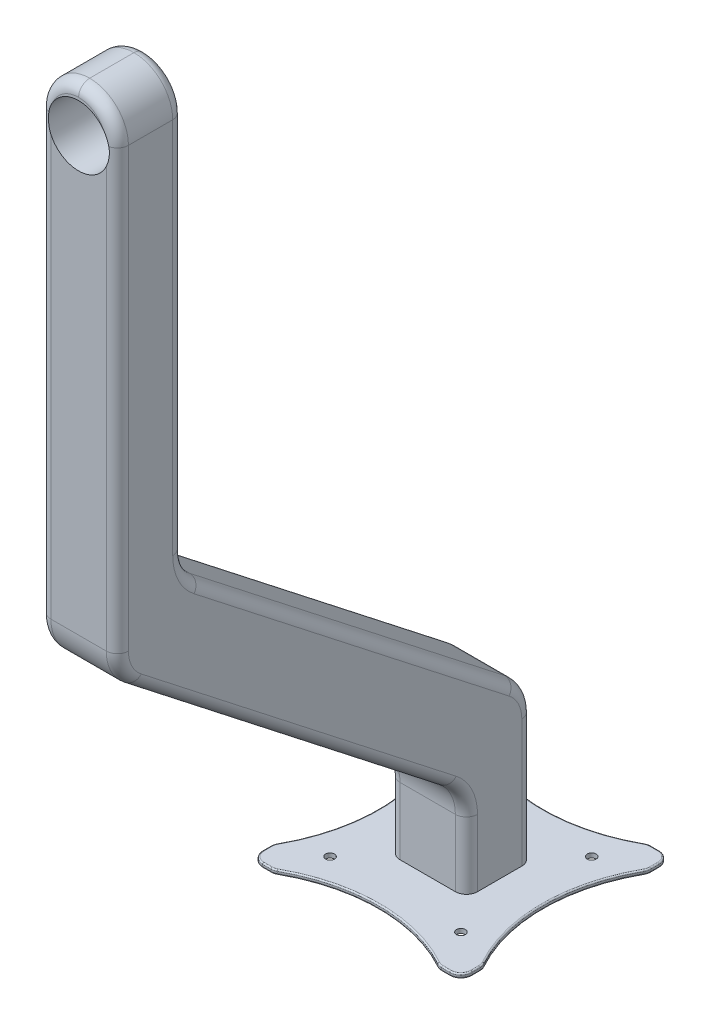
from build123d import *

# Parameters (mm, degrees)
SKETCH1_R           = 2.5526999999999975
BOSS_EXTRUDE1_DEPTH = 2.54
FILLET1_R           = 6.35
BOSS_EXTRUDE2_DEPTH = 22.224999999999998
SKETCH4_R           = 17.462499999999967
CUT_EXTRUDE1_DEPTH  = 555.267869804406
FILLET2_R           = 22.225
FILLET3_R           = 25.4
FILLET4_R           = 6.35
FILLET5_R           = 0.762


# Some blends are built 0.0001 mm under size
with BuildPart() as part:
    # Sketch1 → Boss-Extrude1 (new body)
    with BuildSketch(Plane(origin=(0, 0, 0), x_dir=(1, 0, 0), z_dir=(0, 1, 0))):
        with BuildLine():
            Line((-60, 59.99999999999999), (-47.3, 59.999999999999986))
            ThreePointArc((-47.3, 59.999999999999986), (-1.503e-14, 47.3), (47.29999999999998, 60))
            Line((47.29999999999998, 60), (59.999999999999986, 59.99999999999999))
            Line((59.999999999999986, 59.99999999999999), (60.000000000000014, 47.300000000000026))
            ThreePointArc((60.000000000000014, 47.300000000000026), (47.300000000000026, 3.759e-14), (60.000000000000014, -47.299999999999976))
            Line((60.000000000000014, -47.299999999999976), (60, -60.00000000000001))
            Line((60, -60.00000000000001), (47.30000000000003, -60.00000000000001))
            ThreePointArc((47.30000000000003, -60.00000000000001), (1.936e-14, -47.30000000000001), (-47.299999999999955, -60.000000000000014))
            Line((-47.299999999999955, -60.000000000000014), (-59.999999999999986, -60.00000000000001))
            Line((-59.999999999999986, -60.00000000000001), (-59.99999999999998, -47.30000000000004))
            ThreePointArc((-59.99999999999998, -47.30000000000004), (-47.29999999999998, -3.281e-14), (-59.99999999999999, 47.29999999999997))
            Line((-59.99999999999999, 47.29999999999997), (-60, 59.99999999999999))
        make_face()
        with Locations(Location((-37.500000000000014, 37.49999999999999, 0), (0, 0, 270))):
            Circle(SKETCH1_R, mode=Mode.SUBTRACT)
        with Locations(Location((-37.5, -37.50000000000001, 0), (0, 0, 270))):
            Circle(SKETCH1_R, mode=Mode.SUBTRACT)
        with Locations(Location((37.5, -37.50000000000001, 0), (0, 0, 270))):
            Circle(SKETCH1_R, mode=Mode.SUBTRACT)
        with Locations(Location((37.499999999999986, 37.49999999999999, 0), (0, 0, 270))):
            Circle(SKETCH1_R, mode=Mode.SUBTRACT)
    extrude(amount=BOSS_EXTRUDE1_DEPTH)

    # Fillet1
    fillet1_edges = [part.edges().sort_by_distance(p)[0] for p in [
        (60, 1.27, 60.00000000000001),
        (47.30000000000003, 1.27, 60),
        (-47.29999999999996, 1.27, 60.00000000000001),
        (-59.999999999999986, 1.27, 60.00000000000001),
        (-59.99999999999997, 1.27, 47.30000000000004),
        (-60, 1.27, -47.299999999999976),
        (-60, 1.27, -59.99999999999999),
        (-47.3, 1.27, -59.99999999999998),
        (47.29999999999999, 1.27, -59.99999999999999),
        (59.999999999999986, 1.27, -59.99999999999999),
        (60.00000000000002, 1.27, -47.300000000000026),
        (60.00000000000002, 1.27, 47.29999999999997),
    ]]
    fillet(fillet1_edges, radius=FILLET1_R)

    # Fillet5
    fillet5_edges = [part.edges().sort_by_distance(p)[0] for p in [
        (-59.99999999999998, 0, 51.31264994849446),
        (-59.99999999999998, 2.54, 51.31264994849446),
        (60.00000000000001, 0, 51.312649948494425),
        (51.31264994849447, 0, 60.00000000000001),
        (3.73e-14, 0, 47.30000000000001),
        (-51.31264994849441, 0, 60.000000000000014),
        (-47.29999999999998, 0, 3.375e-14),
        (-59.99999999999999, 0, -51.31264994849441),
        (-51.31264994849443, 0, -59.999999999999986),
        (1.599e-14, 0, -47.30000000000001),
        (51.31264994849445, 0, -60),
        (60.00000000000001, 0, -51.31264994849445),
        (47.300000000000054, 0, -3.73e-14),
        (-58.14012806053456, 0, 58.14012806053459),
        (-47.38137266376465, 0, 59.79669797331757),
        (47.38137266376473, 0, 59.79669797331757),
        (58.14012806053458, 0, 58.140128060534586),
        (59.79669797331757, 0, 47.38137266376462),
        (59.79669797331758, 0, -47.381372663764694),
        (58.14012806053457, 0, -58.14012806053458),
        (47.381372663764694, 0, -59.79669797331757),
        (-47.381372663764665, 0, -59.79669797331754),
        (-58.14012806053458, 0, -58.140128060534565),
        (-59.796697973317556, 0, -47.381372663764644),
        (-59.79669797331754, 0, 47.381372663764715),
        (-47.29999999999998, 2.54, 3.375e-14),
        (60.00000000000001, 2.54, 51.312649948494425),
        (47.300000000000054, 2.54, -3.73e-14),
        (60.00000000000001, 2.54, -51.31264994849445),
        (51.31264994849445, 2.54, -60),
        (1.599e-14, 2.54, -47.30000000000001),
        (-51.31264994849443, 2.54, -59.999999999999986),
        (-59.99999999999999, 2.54, -51.31264994849441),
        (-51.31264994849441, 2.54, 60.000000000000014),
        (3.73e-14, 2.54, 47.30000000000001),
        (51.31264994849447, 2.54, 60.00000000000001),
        (-58.14012806053456, 2.54, 58.14012806053459),
        (-47.38137266376465, 2.54, 59.79669797331757),
        (47.38137266376473, 2.54, 59.79669797331757),
        (58.14012806053458, 2.54, 58.140128060534586),
        (59.79669797331757, 2.54, 47.38137266376462),
        (59.79669797331758, 2.54, -47.381372663764694),
        (58.14012806053457, 2.54, -58.14012806053458),
        (47.381372663764694, 2.54, -59.79669797331757),
        (-47.381372663764665, 2.54, -59.79669797331754),
        (-58.14012806053458, 2.54, -58.140128060534565),
        (-59.796697973317556, 2.54, -47.381372663764644),
        (-59.79669797331754, 2.54, 47.381372663764715),
    ]]
    fillet(fillet5_edges, radius=FILLET5_R)


with BuildPart() as body_2:
    # Sketch3 → Boss-Extrude2 (new, symmetric)
    with BuildSketch(Plane(origin=(0, 0, 0), x_dir=(0, 0, -1), z_dir=(1, 0, 0))):
        Polygon((19.05, 2.540000000000011), (19.049999999999997, 88.03914295578107), (-181.10473141610777, 244.41715768849778), (-181.10473141610774, 495.4607754265523), (-219.20473141610776, 495.4607754265523), (-219.20473141610776, 209.7180147327167), (-19.05, 53.34), (-19.05, 2.5400000000000067), align=None)
    extrude(amount=BOSS_EXTRUDE2_DEPTH, both=True)

    # Sketch4 → Cut-Extrude1 (cut, through all)
    with BuildSketch(Plane(origin=(0, 2.002e-14, 181.1047314161078), x_dir=(-1, 0, 0), z_dir=(0, 0, -1))):
        with Locations((-1.174e-14, 470.0607754265523)):
            Circle(SKETCH4_R)
    extrude(amount=-CUT_EXTRUDE1_DEPTH, mode=Mode.SUBTRACT)

    # Fillet2
    fillet2_edges = [body_2.edges().sort_by_distance(p)[0] for p in [
        (-22.224999999999998, 495.4607754265523, 200.15473141610775),
        (22.224999999999998, 495.4607754265523, 200.15473141610775),
    ]]
    fillet(fillet2_edges, radius=FILLET2_R - 0.0001)  # a hair under: the kernel refuses the full size

    # Fillet3
    fillet3_edges = [body_2.edges().sort_by_distance(p)[0] for p in [
        (0, 53.34, 19.05),
        (0, 209.7180147327167, 219.20473141610776),
        (0, 244.41715768849778, 181.10473141610777),
        (0, 88.03914295578107, -19.049999999999997),
    ]]
    fillet(fillet3_edges, radius=FILLET3_R)

    # Fillet4
    # the kernel refuses this fillet: 6.35 mm, written as the material it takes off along each edge
    with BuildSketch(Plane(origin=(-22.224999999999998, -13.335000000000008, -19.05000000000001), x_dir=(0, -4e-17, 1), z_dir=(0, 1, 4e-17))) as fillet4_piece_1:
        with BuildLine():
            CenterArc((FILLET4_R, FILLET4_R), FILLET4_R, 180, 90)
            Line((-7.11e-15, FILLET4_R), (0, 0))
            Line((0, 0), (FILLET4_R, 0))
        make_face()
    extrude(amount=88.98573520620815, mode=Mode.SUBTRACT)
    with BuildSketch(Plane(origin=(-22.224999999999998, 473.2358754265523, 219.20473141610776), x_dir=(0, 0, -1), z_dir=(0, -1, 0))) as fillet4_piece_2:
        with BuildLine():
            CenterArc((FILLET4_R, FILLET4_R), FILLET4_R, 180, 90)
            Line((0, FILLET4_R), (0, 0))
            Line((0, 0), (FILLET4_R, 0))
        make_face()
    extrude(amount=251.12945294426265, mode=Mode.SUBTRACT)
    with BuildSketch(Plane(origin=(22.224999999999998, 473.2358754265523, 219.20473141610776), x_dir=(-1, 0, 0), z_dir=(0, -1, 0))) as fillet4_piece_3:
        with BuildLine():
            CenterArc((FILLET4_R, FILLET4_R), FILLET4_R, 180, 90)
            Line((-3.55e-15, FILLET4_R), (0, 0))
            Line((0, 0), (FILLET4_R, 0))
        make_face()
    extrude(amount=251.12945294426265, mode=Mode.SUBTRACT)
    with BuildSketch(Plane(origin=(9.999999999977e-05, 473.2358754265523, 219.20473141610776), x_dir=(1, 0, 0), z_dir=(0, -1, 0))) as fillet4_piece_4:
        with BuildLine():
            CenterArc((22.2249 - FILLET4_R, -FILLET4_R), FILLET4_R, 0, 90)
            Line((22.2249, -FILLET4_R), (22.2249, 0))
            Line((22.2249, 0), (22.2249 - FILLET4_R, 0))
        make_face()
    revolve(axis=Axis((9.999999999977e-05, 473.2358754265523, 219.20473141610776), (0, 0, 1)), revolution_arc=90, mode=Mode.SUBTRACT)
    with BuildSketch(Plane(origin=(-9.999999999977e-05, 473.2358754265523, 219.20473141610776), x_dir=(-1, 0, 0), z_dir=(0, -1, 0))) as fillet4_piece_5:
        with BuildLine():
            CenterArc((22.2249 - FILLET4_R, FILLET4_R), FILLET4_R, 270, 90)
            Line((22.2249 - FILLET4_R, 0), (22.2249, 0))
            Line((22.2249, 0), (22.2249, FILLET4_R))
        make_face()
    revolve(axis=Axis((-9.999999999977e-05, 473.2358754265523, 219.20473141610776), (0, 0, -1)), revolution_arc=90, mode=Mode.SUBTRACT)
    with BuildSketch(Plane(origin=(9.999999999977e-05, 473.2358754265523, 181.10473141610774), x_dir=(1, 0, 0), z_dir=(0, -1, 0))) as fillet4_piece_6:
        with BuildLine():
            CenterArc((22.2249 - FILLET4_R, FILLET4_R), FILLET4_R, 270, 90)
            Line((22.2249, FILLET4_R), (22.2249, 0))
            Line((22.2249, 0), (22.2249 - FILLET4_R, 0))
        make_face()
    revolve(axis=Axis((9.999999999977e-05, 473.2358754265523, 181.10473141610774), (0, 0, 1)), revolution_arc=90, mode=Mode.SUBTRACT)
    with BuildSketch(Plane(origin=(-9.999999999977e-05, 473.2358754265523, 181.10473141610774), x_dir=(-1, 0, 0), z_dir=(0, -1, 0))) as fillet4_piece_7:
        with BuildLine():
            CenterArc((22.2249 - FILLET4_R, -FILLET4_R), FILLET4_R, 0, 90)
            Line((22.2249, -FILLET4_R), (22.2249, 0))
            Line((22.2249, 0), (22.2249 - FILLET4_R, 0))
        make_face()
    revolve(axis=Axis((-9.999999999977e-05, 473.2358754265523, 181.10473141610774), (0, 0, -1)), revolution_arc=90, mode=Mode.SUBTRACT)
    with BuildSketch(Plane(origin=(-22.224999999999998, 40.951592250427126, 19.05), x_dir=(0, 0, -1), z_dir=(0, -1, 0)), Plane(origin=(22.224999999999998, 40.951592250427126, 19.05), x_dir=(-1, 0, 0), z_dir=(0, -1, 0))) as fillet4_piece_8:
        with BuildLine():
            CenterArc((FILLET4_R, FILLET4_R), FILLET4_R, 180, 90)
            Line((-3.55e-15, FILLET4_R), (0, 0))
            Line((0, 0), (FILLET4_R, 0))
        make_face()
    extrude(amount=54.286592250427105, mode=Mode.SUBTRACT)
    with BuildSketch(Plane(origin=(-22.224999999999998, 202.09094934067886, 209.44253288937944), x_dir=(0, 0.7880107536067236, -0.6156614753256564), z_dir=(0, -0.6156614753256564, -0.7880107536067236))) as fillet4_piece_9:
        with BuildLine():
            CenterArc((FILLET4_R, FILLET4_R), FILLET4_R, 180, 90)
            Line((4.9e-15, FILLET4_R), (0, 0))
            Line((0, 0), (FILLET4_R, 0))
        make_face()
    extrude(amount=229.22318450085416, mode=Mode.SUBTRACT)
    with BuildSketch(Plane(origin=(22.224999999999998, 202.09094934067886, 209.44253288937944), x_dir=(-1, 6.1e-16, -4.7e-16), z_dir=(0, -0.6156614753256564, -0.7880107536067236))) as fillet4_piece_10:
        with BuildLine():
            CenterArc((FILLET4_R, FILLET4_R), FILLET4_R, 180, 89.99999999999994)
            Line((1.35e-15, FILLET4_R), (0, 0))
            Line((0, 0), (FILLET4_R, 0))
        make_face()
    extrude(amount=229.22318450085416, mode=Mode.SUBTRACT)
    with BuildSketch(Plane(origin=(-22.224999999999998, 95.66620834781894, -9.287801473271667), x_dir=(0, -0.7880107536067235, 0.6156614753256563), z_dir=(0, 0.6156614753256564, 0.7880107536067236))) as fillet4_piece_11:
        with BuildLine():
            CenterArc((FILLET4_R, FILLET4_R), FILLET4_R, 180, 90)
            Line((-1.229e-14, FILLET4_R), (0, 0))
            Line((0, 0), (FILLET4_R, 0))
        make_face()
    extrude(amount=229.2231845008542, mode=Mode.SUBTRACT)
    with BuildSketch(Plane(origin=(22.224999999999998, 95.66620834781894, -9.287801473271667), x_dir=(-1, -2.7e-16, 2.1e-16), z_dir=(0, 0.6156614753256564, 0.7880107536067236))) as fillet4_piece_12:
        with BuildLine():
            CenterArc((FILLET4_R, FILLET4_R), FILLET4_R, 180.00000000000003, 89.99999999999994)
            Line((-1.37e-15, FILLET4_R), (0, 0))
            Line((0, 0), (FILLET4_R, 0))
        make_face()
    extrude(amount=229.2231845008542, mode=Mode.SUBTRACT)
    with BuildSketch(Plane(origin=(-22.224999999999998, 256.80556543807074, 181.10473141610777), x_dir=(0, 1.1e-16, 1), z_dir=(0, 1, -1.1e-16))) as fillet4_piece_13:
        with BuildLine():
            CenterArc((FILLET4_R, FILLET4_R), FILLET4_R, 180, 90)
            Line((0, FILLET4_R), (0, 0))
            Line((0, 0), (FILLET4_R, 0))
        make_face()
    extrude(amount=216.43030998848155, mode=Mode.SUBTRACT)
    with BuildSketch(Plane(origin=(-22.224999999999998, 222.10642248228964, 193.80473141610776), x_dir=(0, 0, 1), z_dir=(0, 1, 0))) as fillet4_piece_14:
        with BuildLine():
            CenterArc((25.400000000000006 - FILLET4_R, FILLET4_R), FILLET4_R, 270, 89.99999999999999)
            Line((25.400000000000006, FILLET4_R), (25.400000000000006, 0))
            Line((25.400000000000006, 0), (25.400000000000006 - FILLET4_R, 0))
        make_face()
    revolve(axis=Axis((-22.224999999999998, 222.10642248228964, 193.80473141610776), (1, 0, 0)), revolution_arc=52.000000000000135, mode=Mode.SUBTRACT)
    with BuildSketch(Plane(origin=(-22.224999999999998, 75.65073520620814, 6.350000000000001), x_dir=(0, 0.7880107536067232, -0.6156614753256565), z_dir=(0, 0.6156614753256565, 0.7880107536067232))) as fillet4_piece_15:
        with BuildLine():
            CenterArc((25.399999999999995 - FILLET4_R, -FILLET4_R), FILLET4_R, 1.603e-14, 90)
            Line((25.39999999999999, -FILLET4_R), (25.399999999999995, 0))
            Line((25.399999999999995, 0), (25.399999999999995 - FILLET4_R, 0))
        make_face()
    revolve(axis=Axis((-22.224999999999998, 75.65073520620814, 6.350000000000001), (-1, 0, 0)), revolution_arc=52.00000000000012, mode=Mode.SUBTRACT)
    with BuildSketch(Plane(origin=(22.224999999999998, 256.80556543807074, 181.10473141610777), x_dir=(-1, 0, 0), z_dir=(0, 1, -1.1e-16))) as fillet4_piece_16:
        with BuildLine():
            CenterArc((FILLET4_R, FILLET4_R), FILLET4_R, 180, 90)
            Line((-3.55e-15, FILLET4_R), (0, 0))
            Line((0, 0), (FILLET4_R, 0))
        make_face()
    extrude(amount=216.43030998848155, mode=Mode.SUBTRACT)
    with BuildSketch(Plane(origin=(22.224999999999998, 222.10642248228964, 193.80473141610776), x_dir=(0, 0, 1), z_dir=(0, 1, 0))) as fillet4_piece_17:
        with BuildLine():
            CenterArc((25.400000000000006 - FILLET4_R, -FILLET4_R), FILLET4_R, 0, 90)
            Line((25.400000000000006 - FILLET4_R, -3.55e-15), (25.400000000000006, 0))
            Line((25.400000000000006, 0), (25.400000000000006, -FILLET4_R))
        make_face()
    revolve(axis=Axis((22.224999999999998, 222.10642248228964, 193.80473141610776), (1, 0, 0)), revolution_arc=52.000000000000135, mode=Mode.SUBTRACT)
    with BuildSketch(Plane(origin=(22.224999999999998, 75.65073520620814, 6.350000000000001), x_dir=(0, 0.7880107536067232, -0.6156614753256565), z_dir=(0, 0.6156614753256565, 0.7880107536067232))) as fillet4_piece_18:
        with BuildLine():
            CenterArc((25.399999999999995 - FILLET4_R, FILLET4_R), FILLET4_R, 269.99999999999994, 90.00000000000006)
            Line((25.399999999999995 - FILLET4_R, 3.55e-15), (25.399999999999995, 0))
            Line((25.399999999999995, 0), (25.399999999999995, FILLET4_R))
        make_face()
    revolve(axis=Axis((22.224999999999998, 75.65073520620814, 6.350000000000001), (-1, 0, 0)), revolution_arc=52.00000000000012, mode=Mode.SUBTRACT)
    with BuildSketch(Plane(origin=(-22.224999999999998, 40.951592250427126, 44.45000000000002), x_dir=(0, 0.7880107536067233, -0.6156614753256565), z_dir=(0, 0.6156614753256565, 0.7880107536067233))) as fillet4_piece_19:
        with BuildLine():
            CenterArc((25.399999999999995 + FILLET4_R, -FILLET4_R), FILLET4_R, 90, 90)
            Line((25.40000000000001, -FILLET4_R), (25.399999999999995, 0))
            Line((25.399999999999995, 0), (25.399999999999995 + FILLET4_R, 0))
        make_face()
    revolve(axis=Axis((-22.224999999999998, 40.951592250427126, 44.45000000000002), (-1, 0, 0)), revolution_arc=52.00000000000012, mode=Mode.SUBTRACT)
    with BuildSketch(Plane(origin=(22.224999999999998, 40.951592250427126, 44.45000000000002), x_dir=(0, 0.7880107536067233, -0.6156614753256565), z_dir=(0, 0.6156614753256565, 0.7880107536067233))) as fillet4_piece_20:
        with BuildLine():
            CenterArc((25.399999999999995 + FILLET4_R, FILLET4_R), FILLET4_R, 180, 90.00000000000011)
            Line((25.399999999999995 + FILLET4_R, -3.55e-15), (25.399999999999995, 0))
            Line((25.399999999999995, 0), (25.4, FILLET4_R))
        make_face()
    revolve(axis=Axis((22.224999999999998, 40.951592250427126, 44.45000000000002), (-1, 0, 0)), revolution_arc=52.00000000000012, mode=Mode.SUBTRACT)
    with BuildSketch(Plane(origin=(-22.224999999999998, 256.8055654380707, 155.70473141610776), x_dir=(0, 2.24e-15, 1), z_dir=(0, 1, -2.24e-15))) as fillet4_piece_21:
        with BuildLine():
            CenterArc((25.400000000000006 + FILLET4_R, FILLET4_R), FILLET4_R, 180, 90)
            Line((25.400000000000006, FILLET4_R), (25.400000000000006, 0))
            Line((25.400000000000006, 0), (25.400000000000006 + FILLET4_R, 0))
        make_face()
    revolve(axis=Axis((-22.224999999999998, 256.8055654380707, 155.70473141610776), (1, 0, 0)), revolution_arc=52.00000000000025, mode=Mode.SUBTRACT)
    with BuildSketch(Plane(origin=(22.224999999999998, 256.8055654380707, 155.70473141610776), x_dir=(0, 2.24e-15, 1), z_dir=(0, 1, -2.24e-15))) as fillet4_piece_22:
        with BuildLine():
            CenterArc((25.400000000000006 + FILLET4_R, -FILLET4_R), FILLET4_R, 90, 90)
            Line((25.400000000000006 + FILLET4_R, -3.55e-15), (25.400000000000006, 0))
            Line((25.400000000000006, 0), (25.400000000000006, -FILLET4_R))
        make_face()
    revolve(axis=Axis((22.224999999999998, 256.8055654380707, 155.70473141610776), (1, 0, 0)), revolution_arc=52.00000000000025, mode=Mode.SUBTRACT)
    with BuildSketch(Plane(origin=(22.224999999999998, -13.335000000000019, -19.05), x_dir=(-1, 0, 0), z_dir=(0, 1, 4e-17))) as fillet4_piece_23:
        with BuildLine():
            CenterArc((FILLET4_R, FILLET4_R), FILLET4_R, 179.9999999999999, 90.00000000000011)
            Line((-3.55e-15, FILLET4_R), (0, 0))
            Line((0, 0), (FILLET4_R, 0))
        make_face()
    extrude(amount=88.98573520620815, mode=Mode.SUBTRACT)
    with BuildSketch(Plane(origin=(-9.999999999977e-05, 495.4607754265523, 181.10473141610774), x_dir=(0, -1, 0), z_dir=(1, 0, 0))) as fillet4_piece_24:
        with BuildLine():
            CenterArc((FILLET4_R, -FILLET4_R), FILLET4_R, 90, 90)
            Line((-5.684e-14, -FILLET4_R), (0, 0))
            Line((0, 0), (FILLET4_R, 0))
        make_face()
    extrude(amount=0.00019999999999953, mode=Mode.SUBTRACT)
    with BuildSketch(Plane(origin=(-9.999999999977e-05, 495.4607754265523, 219.20473141610776), x_dir=(0, -1, 0), z_dir=(1, 0, 0))) as fillet4_piece_25:
        with BuildLine():
            CenterArc((FILLET4_R, FILLET4_R), FILLET4_R, 180, 90)
            Line((0, FILLET4_R), (0, 0))
            Line((0, 0), (FILLET4_R, 0))
        make_face()
    extrude(amount=0.00019999999999953, mode=Mode.SUBTRACT)


solid = Compound([part.part, body_2.part])
